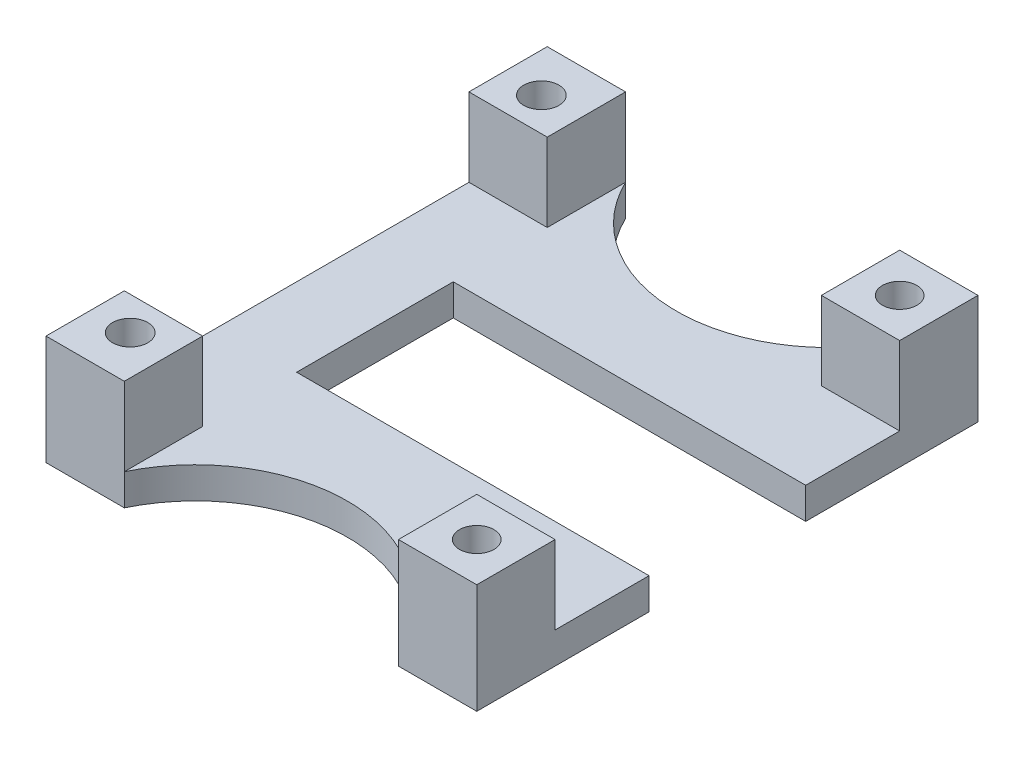
from build123d import *

# Parameters (mm, degrees)
SKETCH1_R          = 2.2
SKETCH1_R_2        = 2.2479
EXTRUDE_BODY_DEPTH = 4
SKETCH5_W          = 10
SKETCH5_H          = 10
SKETCH5_R          = 2.2
SKETCH5_R_2        = 2.2479
EXTRUDE_LEGS_DEPTH = 10


with BuildPart() as part:
    # Sketch1 → Extrude-Body (new body)
    with BuildSketch(Plane(origin=(0, 0, 0), x_dir=(1, 0, 0), z_dir=(0, 1, 0))):
        with BuildLine():
            Line((10, -10), (10, 10))
            Line((10, 10), (55, 10))
            Line((55, 10), (55, 32))
            Line((55, 32), (45, 32))
            ThreePointArc((45, 32), (27.5, 21), (10, 32))
            Line((10, 32), (0, 32))
            Line((0, 32), (0, -32))
            Line((0, -32), (10, -32))
            ThreePointArc((10, -32), (27.5, -21), (45, -32))
            Line((45, -32), (55, -32))
            Line((55, -32), (55, -10))
            Line((55, -10), (10, -10))
        make_face()
        with Locations((50, -27)):
            Circle(SKETCH1_R, mode=Mode.SUBTRACT)
        with Locations((5, -26.25)):
            Circle(SKETCH1_R_2, mode=Mode.SUBTRACT)
        with Locations((50, 27)):
            Circle(SKETCH1_R, mode=Mode.SUBTRACT)
        with Locations((5, 26.25)):
            Circle(SKETCH1_R_2, mode=Mode.SUBTRACT)
    extrude(amount=EXTRUDE_BODY_DEPTH)

    # Sketch5 → Extrude-Legs (add)
    # profile 1 of 4: a face of its own
    with BuildSketch(Plane(origin=(0, 4, 0), x_dir=(1, 0, 0), z_dir=(0, 1, 0))):
        with Locations((50, -27)):
            Rectangle(SKETCH5_W, SKETCH5_H)
        with Locations((50, -27)):
            Circle(SKETCH5_R, mode=Mode.SUBTRACT)
    # profile 2 of 4: a face of its own
    with BuildSketch(Plane(origin=(0, 4, 0), x_dir=(1, 0, 0), z_dir=(0, 1, 0))):
        with Locations((50, 27)):
            Rectangle(SKETCH5_W, SKETCH5_H)
        with Locations((50, 27)):
            Circle(SKETCH5_R, mode=Mode.SUBTRACT)
    # profile 3 of 4: a face of its own
    with BuildSketch(Plane(origin=(0, 4, 0), x_dir=(1, 0, 0), z_dir=(0, 1, 0))):
        with Locations((5, 27)):
            Rectangle(SKETCH5_W, SKETCH5_H)
        with Locations((5, 26.25)):
            Circle(SKETCH5_R_2, mode=Mode.SUBTRACT)
    # profile 4 of 4: a face of its own
    with BuildSketch(Plane(origin=(0, 4, 0), x_dir=(1, 0, 0), z_dir=(0, 1, 0))):
        with Locations((5, -27)):
            Rectangle(SKETCH5_W, SKETCH5_H)
        with Locations((5, -26.25)):
            Circle(SKETCH5_R_2, mode=Mode.SUBTRACT)
    extrude(amount=EXTRUDE_LEGS_DEPTH)


solid = part.part
